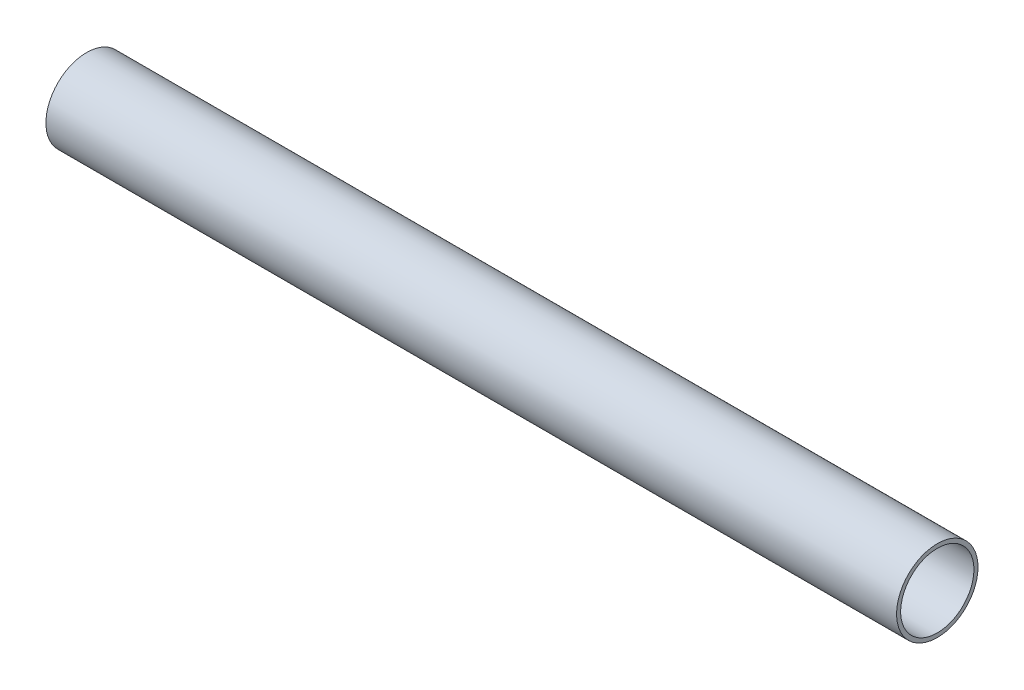
from build123d import *

# Parameters (mm, degrees)
SKETCH1_R           = 15.875
SKETCH1_R_2         = 14.2875
EXTRUDE_THIN1_DEPTH = 165.89375


with BuildPart() as part:
    # Sketch1 → Extrude-Thin1 (new, symmetric)
    with BuildSketch(Plane(origin=(0, 0, 0), x_dir=(0, 0, -1), z_dir=(1, 0, 0))):
        Circle(SKETCH1_R)
        Circle(SKETCH1_R_2, mode=Mode.SUBTRACT)
    extrude(amount=EXTRUDE_THIN1_DEPTH, both=True)


solid = part.part
